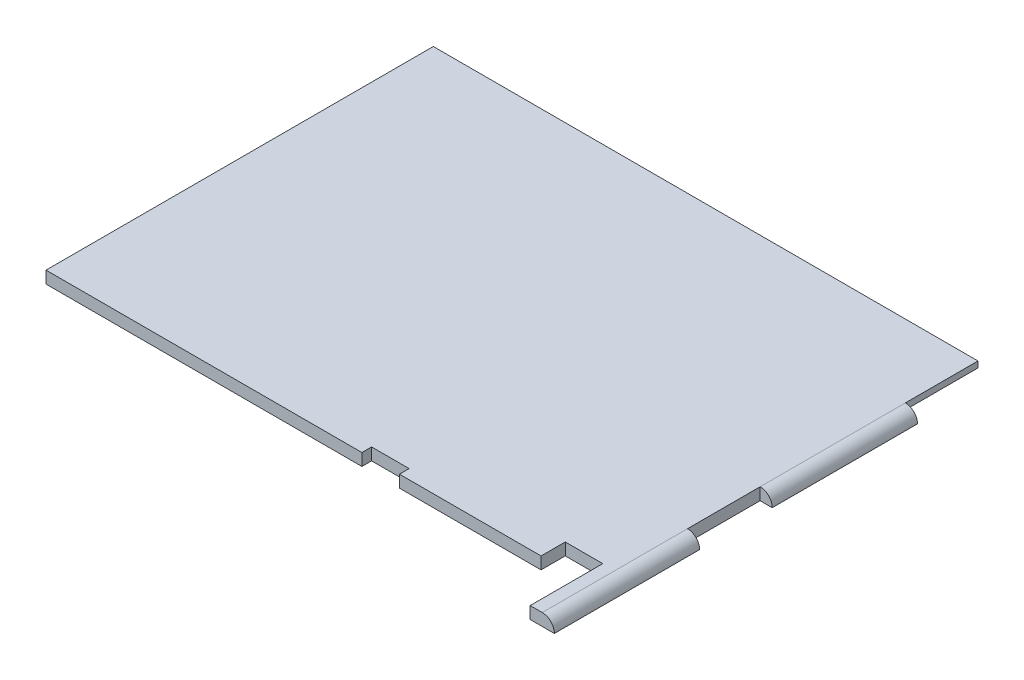
from build123d import *

# Parameters (mm, degrees)
SKETCH_1_W          = 5
SKETCH_1_H          = 60
SKETCH_1_W_2        = 30
SKETCH_1_H_2        = 5
SKETCH_1_W_3        = 15
EXTRUDE_1_DEPTH     = 5
FILLET_1_R          = 5
SKETCH_2_W          = 245
SKETCH_2_H          = 155
CUT_EXTRUDE_1_DEPTH = 5
SKETCH_3_W          = 30
SKETCH_3_H          = 2.5
CUT_EXTRUDE_2_DEPTH = 365.296775248


with BuildPart() as part:
    # 草圖1 → 填料-伸長1 (new body)
    with BuildSketch(Plane(origin=(0, 0, 0), x_dir=(1, 0, 0), z_dir=(0, 1, 0))):
        Polygon((198.746286718, -286.464902661), (198.746286718, -256.464902661), (183.246286718, -256.464902661), (183.246286718, -266.464902661), (124.746286718, -266.464902661), (124.746286718, -262.464902661), (109.246286718, -262.464902661), (109.246286718, -266.464902661), (-21.253713282, -266.464902661), (-21.253713282, 38.535097339), (-36.253713282, 38.535097339), (-36.253713282, 43.535097339), (203.746286718, 43.535097339), (203.746286718, -286.464902661), align=None)
        with Locations((206.246286718, -256.464902661)):
            Rectangle(SKETCH_1_W, SKETCH_1_H)
        with Locations((206.246286718, 13.535097339)):
            Rectangle(SKETCH_1_W, SKETCH_1_H)
        with Locations((188.746286718, 46.035097339)):
            Rectangle(SKETCH_1_W_2, SKETCH_1_H_2)
        with Locations((-21.253713282, 46.035097339)):
            Rectangle(SKETCH_1_W_2, SKETCH_1_H_2)
        with Locations((91.246286718, 46.035097339)):
            Rectangle(SKETCH_1_W_3, SKETCH_1_H_2)
        with Locations((76.246286718, 46.035097339)):
            Rectangle(SKETCH_1_W_3, SKETCH_1_H_2)
        with Locations((206.246286718, -166.464902661)):
            Rectangle(SKETCH_1_W, SKETCH_1_H)
        with Locations((206.246286718, -76.464902661)):
            Rectangle(SKETCH_1_W, SKETCH_1_H)
    extrude(amount=EXTRUDE_1_DEPTH)

    # 圓角1
    fillet_1_edges = [part.edges().sort_by_distance(p)[0] for p in [
        (208.746286718, 5, -13.535097339),
        (208.746286718, 5, 76.464902661),
        (208.746286718, 5, 166.464902661),
        (208.746286718, 5, 256.464902661),
    ]]
    fillet(fillet_1_edges, radius=FILLET_1_R - 0.0001)  # a hair under: the kernel refuses the full size

    # 草圖2 → 除料-伸長1 (cut)
    with BuildSketch(Plane(origin=(0, 5, 0), x_dir=(1, 0, 0), z_dir=(0, 1, 0))):
        with Locations((86.246286718, -28.964902661)):
            Rectangle(SKETCH_2_W, SKETCH_2_H)
    extrude(amount=-CUT_EXTRUDE_1_DEPTH, mode=Mode.SUBTRACT)

    # 草圖3 → 除料-伸長2 (cut, through all)
    with BuildSketch(Plane(origin=(203.746286718, 0, 0), x_dir=(0, 0, -1), z_dir=(1, 0, 0))):
        with Locations((-121.464902661, 1.25)):
            Rectangle(SKETCH_3_W, SKETCH_3_H)
    extrude(amount=-CUT_EXTRUDE_2_DEPTH, mode=Mode.SUBTRACT)


solid = part.part
